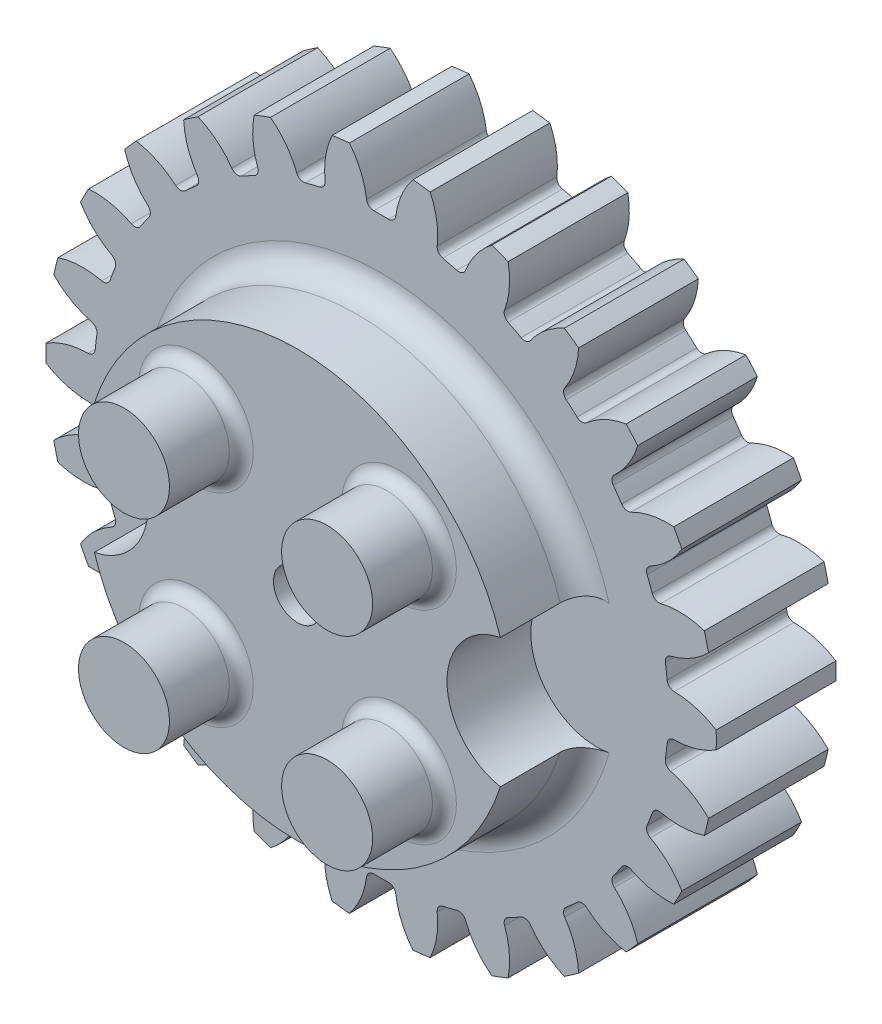
from build123d import *

# Parameters (mm, degrees)
SKETCH1_R                 = 14
BOSS_EXTRUDE1_DEPTH       = 2.5
CUT_EXTRUDE1_DEPTH        = 20.956202043
FILLET2_R                 = 0.3
CIRPATTERN1_COUNT         = 26
FILLET2_OF_CIRPATTERN1_R  = 0.3
BOSS_EXTRUDE2_DEPTH       = 3.5
SKETCH7_R                 = 1.9
BOSS_EXTRUDE3_DEPTH       = 3
FILLET3_R                 = 1
FILLET4_R                 = 0.5
SKETCH8_R                 = 1
THROUGH_CENTER_HOLE_DEPTH = 23.858068749


with BuildPart() as part:
    # Sketch1 → Boss-Extrude1 (new, symmetric)
    with BuildSketch(Plane.XY):
        Circle(SKETCH1_R)
    extrude(amount=BOSS_EXTRUDE1_DEPTH, both=True)

    # Sketch3 → Cut-Extrude1 (cut, symmetric)
    with BuildSketch(Plane.XY):
        with BuildLine():
            ThreePointArc((-1.32615937, 13.937047798), (-0.801193796, 13.020049169), (-0.585229875, 11.985720921))
            ThreePointArc((-0.585229875, 11.985720921), (0, 12), (0.585229875, 11.985720921))
            ThreePointArc((0.585229875, 11.985720921), (0.801193796, 13.020049169), (1.32615937, 13.937047798))
            ThreePointArc((1.32615937, 13.937047798), (0, 14), (-1.32615937, 13.937047798))
        make_face()
    cut_extrude1 = extrude(amount=CUT_EXTRUDE1_DEPTH, both=True, mode=Mode.SUBTRACT)

    # Fillet2
    fillet2_edges = [part.edges().sort_by_distance(p)[0] for p in [
        (0.585229875, 11.985720921, 0),
        (-0.585229875, 11.985720921, 0),
    ]]
    fillet(fillet2_edges, radius=FILLET2_R)

    # CirPattern1: Cut-Extrude1 ×26 about axis
    cirpattern1_axis = Axis((0, 0, 0), (0, 0, 1))
    for i in range(1, CIRPATTERN1_COUNT):
        add(cut_extrude1.rotate(cirpattern1_axis, i * 360 / CIRPATTERN1_COUNT), mode=Mode.SUBTRACT)

    # Fillet2 of CirPattern1
    fillet2_of_cirpattern1_edges = [part.edges().sort_by_distance(p)[0] for p in [
        (-2.300146606, 11.77749233, 0),
        (-3.436594923, 11.497382978, 0),
        (-5.051846926, 10.884798695, 0),
        (-6.088237565, 10.340858927, 0),
        (-7.509952266, 9.359520124, 0),
        (-8.38605397, 8.583361744, 0),
        (-9.531606478, 7.290300264, 0),
        (-10.1965034, 6.327030774, 0),
        (-10.999318368, 4.797394652, 0),
        (-11.414369115, 3.702995774, 0),
        (-11.827789854, 2.025681901, 0),
        (-11.968873187, 0.86375612, 0),
        (-11.968873187, -0.86375612, 0),
        (-11.827789854, -2.025681901, 0),
        (-11.414369115, -3.702995774, 0),
        (-10.999318368, -4.797394652, 0),
        (-10.1965034, -6.327030774, 0),
        (-9.531606478, -7.290300264, 0),
        (-8.38605397, -8.583361744, 0),
        (-7.509952266, -9.359520124, 0),
        (-6.088237565, -10.340858927, 0),
        (-5.051846926, -10.884798695, 0),
        (-3.436594923, -11.497382978, 0),
        (-2.300146606, -11.77749233, 0),
        (-0.585229875, -11.985720921, 0),
        (0.585229875, -11.985720921, 0),
        (2.300146606, -11.77749233, 0),
        (3.436594923, -11.497382978, 0),
        (5.051846926, -10.884798695, 0),
        (6.088237565, -10.340858927, 0),
        (7.509952266, -9.359520124, 0),
        (8.38605397, -8.583361744, 0),
        (9.531606478, -7.290300264, 0),
        (10.1965034, -6.327030774, 0),
        (10.999318368, -4.797394652, 0),
        (11.414369115, -3.702995774, 0),
        (11.827789854, -2.025681901, 0),
        (11.968873187, -0.86375612, 0),
        (11.968873187, 0.86375612, 0),
        (11.827789854, 2.025681901, 0),
        (11.414369115, 3.702995774, 0),
        (10.999318368, 4.797394652, 0),
        (10.1965034, 6.327030774, 0),
        (9.531606478, 7.290300264, 0),
        (8.38605397, 8.583361744, 0),
        (7.509952266, 9.359520124, 0),
        (6.088237565, 10.340858927, 0),
        (5.051846926, 10.884798695, 0),
        (3.436594923, 11.497382978, 0),
        (2.300146606, 11.77749233, 0),
    ]]
    fillet(fillet2_of_cirpattern1_edges, radius=FILLET2_OF_CIRPATTERN1_R)

    # Sketch6 → Boss-Extrude2 (add)
    with BuildSketch(Plane.XY.offset(2.5)):
        with BuildLine():
            ThreePointArc((-8.480416667, -2.700469063), (-6.25, 0), (-8.480416667, 2.700469063))
            ThreePointArc((-8.480416667, 2.700469063), (0, 8.9), (8.480416667, 2.700469063))
            ThreePointArc((8.480416667, 2.700469063), (6.25, 0), (8.480416667, -2.700469063))
            ThreePointArc((8.480416667, -2.700469063), (0, -8.9), (-8.480416667, -2.700469063))
        make_face()
    extrude(amount=BOSS_EXTRUDE2_DEPTH)

    # Sketch7 → Boss-Extrude3 (add)
    with BuildSketch(Plane.XY.offset(6)):
        with Locations((-4.242640687, 4.242640687)):
            Circle(SKETCH7_R)
        with Locations((4.242640687, 4.242640687)):
            Circle(SKETCH7_R)
        with Locations((4.242640687, -4.242640687)):
            Circle(SKETCH7_R)
        with Locations((-4.242640687, -4.242640687)):
            Circle(SKETCH7_R)
    extrude(amount=BOSS_EXTRUDE3_DEPTH)

    # Fillet3
    # the kernel refuses this fillet: 1 mm, written as the material it adds along each edge
    with BuildSketch(Plane(origin=(0, 0, 2.5), x_dir=(0.9996330098529925, -0.02708958494047193, 0), z_dir=(0.02708958494047193, 0.9996330098529925, 0))) as fillet3_piece_1_section:
        with BuildLine():
            CenterArc((8.9 + FILLET3_R, -FILLET3_R), FILLET3_R, 90, 90)
            Line((8.9, -FILLET3_R), (8.9, 0))
            Line((8.9, 0), (8.9 + FILLET3_R, 0))
        make_face()
    fillet3_piece_1 = revolve(axis=Axis((0, 0, 2.5), (0, 0, -1)), revolution_arc=176.895382431, mode=Mode.PRIVATE)
    fillet3_piece_1 = fillet3_piece_1 - Plane(origin=(9, 0, 2.780116287), x_dir=(-0.18893939393939513, 0.9819887501482969, 0), z_dir=(0, 0, -1)) * Cylinder(2.75, 40, mode=Mode.PRIVATE)
    fillet3_piece_1 = fillet3_piece_1 - Plane(origin=(-9, 0, 2.780116287), x_dir=(0.18893939393939513, -0.9819887501482969, 0), z_dir=(0, 0, -1)) * Cylinder(2.75, 40, mode=Mode.PRIVATE)
    add(fillet3_piece_1)
    with BuildSketch(Plane(origin=(0, 0, 2.5), x_dir=(-0.9996330098529925, 0.027089584940471288, 0), z_dir=(-0.027089584940471288, -0.9996330098529925, 0))) as fillet3_piece_2_section:
        with BuildLine():
            CenterArc((8.9 + FILLET3_R, -FILLET3_R), FILLET3_R, 90, 90)
            Line((8.9, -FILLET3_R), (8.9, 0))
            Line((8.9, 0), (8.9 + FILLET3_R, 0))
        make_face()
    fillet3_piece_2 = revolve(axis=Axis((0, 0, 2.5), (0, 0, -1)), revolution_arc=176.895382431, mode=Mode.PRIVATE)
    fillet3_piece_2 = fillet3_piece_2 - Plane(origin=(9, 0, 2.780116287), x_dir=(-0.18893939393939513, 0.9819887501482969, 0), z_dir=(0, 0, -1)) * Cylinder(2.75, 40, mode=Mode.PRIVATE)
    fillet3_piece_2 = fillet3_piece_2 - Plane(origin=(-9, 0, 2.780116287), x_dir=(0.18893939393939513, -0.9819887501482969, 0), z_dir=(0, 0, -1)) * Cylinder(2.75, 40, mode=Mode.PRIVATE)
    add(fillet3_piece_2)

    # Fillet4
    fillet4_edges = [part.edges().sort_by_distance(p)[0] for p in [
        (-6.142640687, 4.242640687, 6),
        (2.342640687, 4.242640687, 6),
        (2.342640687, -4.242640687, 6),
        (-6.142640687, -4.242640687, 6),
    ]]
    fillet(fillet4_edges, radius=FILLET4_R)

    # Sketch8 → Through_Center_Hole (cut, through all)
    with BuildSketch(Plane(origin=(0, 0, -2.5), x_dir=(-1, 0, 0), z_dir=(0, 0, -1))):
        Circle(SKETCH8_R)
    extrude(amount=-THROUGH_CENTER_HOLE_DEPTH, mode=Mode.SUBTRACT)


solid = part.part
